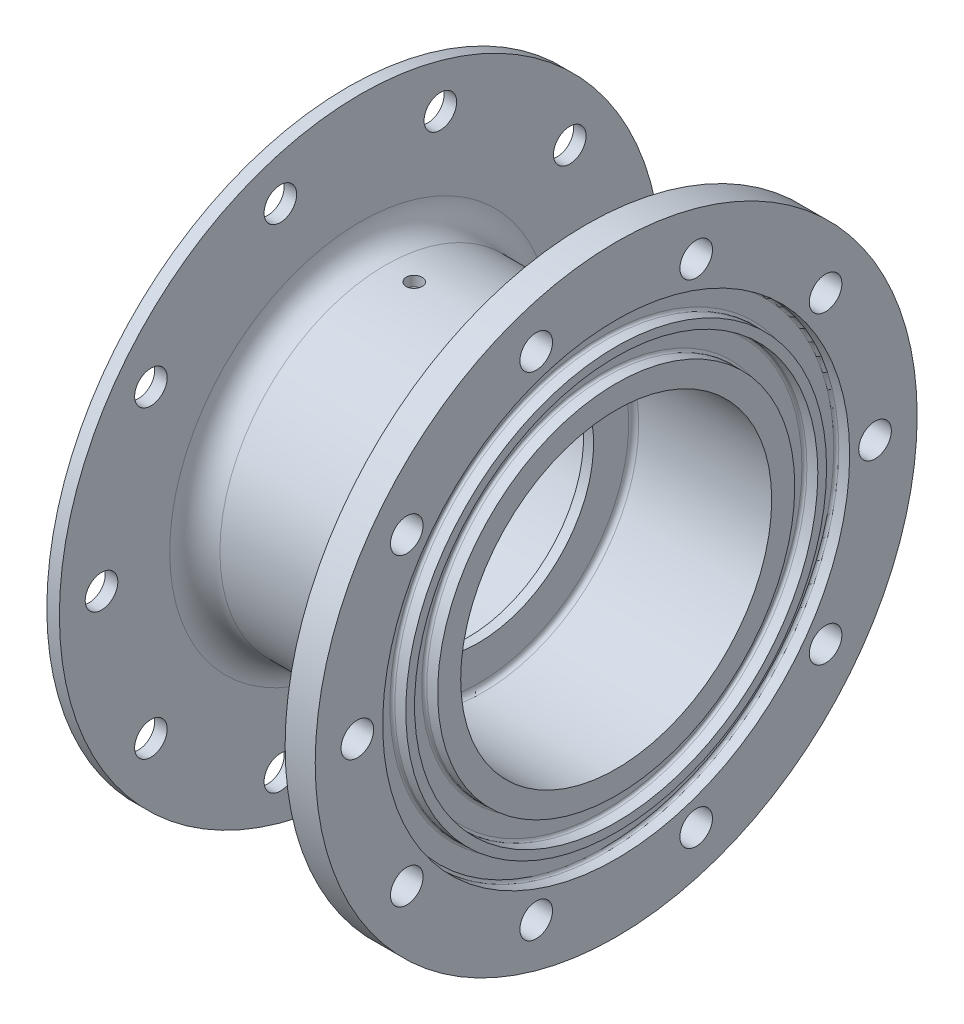
from build123d import *

# Parameters (mm, degrees)
SKETCH3_R                      = 3.25
CUT_EXTRUDE3_DEPTH             = 101.310767119
CIRPATTERN1_COUNT              = 10
F_3_2_3_2_DIAMETER_HOLE1_D     = 3.2
F_3_2_3_2_DIAMETER_HOLE1_DEPTH = 5
F_3_2_3_2_DIAMETER_HOLE1_TIP   = 0.96137699


with BuildPart() as part:
    # Sketch1 → Revolve9 (revolve)
    with BuildSketch(Plane.XY):
        with BuildLine():
            Line((-1, -23), (-1, -30))
            ThreePointArc((-1, -30), (-1.292893219, -30.707106781), (-2, -31))
            Line((-2, -31), (-25, -31))
            Line((-25, -31), (-25, -60))
            Line((-25, -60), (-22.5, -60))
            Line((-22.5, -60), (-22.5, -38))
            ThreePointArc((-22.5, -38), (-21.035533906, -34.464466094), (-17.5, -33))
            Line((-17.5, -33), (17.5, -33))
            ThreePointArc((17.5, -33), (21.035533906, -34.464466094), (22.5, -38))
            Line((22.5, -38), (22.5, -60))
            Line((22.5, -60), (25, -60))
            Line((25, -60), (28.5, -60))
            Line((28.5, -60), (28.5, -31))
            Line((28.5, -31), (25, -31))
            Line((25, -31), (2, -31))
            ThreePointArc((2, -31), (1.292893219, -30.707106781), (1, -30))
            Line((1, -30), (1, -23))
            Line((1, -23), (-1, -23))
        make_face()
    revolve(axis=Axis((-117.507853403, 0, 0), (1, 0, 0)))

    # Sketch3 → Cut-Extrude3 (cut, through all)
    with BuildSketch(Plane.ZY.offset(25)):
        with Locations((-15.94527691, -49.074516241)):
            Circle(SKETCH3_R)
    cut_extrude3 = extrude(amount=-CUT_EXTRUDE3_DEPTH, mode=Mode.SUBTRACT)

    # CirPattern1: Cut-Extrude3 ×10 about axis
    cirpattern1_axis = Axis((0, 0, 0), (-1, 0, 0))
    for i in range(1, CIRPATTERN1_COUNT):
        add(cut_extrude3.rotate(cirpattern1_axis, i * 360 / CIRPATTERN1_COUNT), mode=Mode.SUBTRACT)

    # Ø3.2 (3.2) Diameter Hole1
    with Locations(Plane(origin=(-11.75, 33, 0), x_dir=(0, 0, 1), z_dir=(0, 1, 0))):
        with Locations((0, 0)):
            Hole(F_3_2_3_2_DIAMETER_HOLE1_D / 2, depth=F_3_2_3_2_DIAMETER_HOLE1_DEPTH)
            with Locations((0, 0, -(F_3_2_3_2_DIAMETER_HOLE1_DEPTH + F_3_2_3_2_DIAMETER_HOLE1_TIP / 2))):  # 118° drill point
                Cone(0, F_3_2_3_2_DIAMETER_HOLE1_D / 2, F_3_2_3_2_DIAMETER_HOLE1_TIP, mode=Mode.SUBTRACT)

    # Sketch8 → Cut-Revolve1 (revolve, cut)
    with BuildSketch(Plane.XY):
        with BuildLine():
            Line((28.5, 40.195), (26.33, 40.195))
            ThreePointArc((26.33, 40.195), (25.976446609, 40.048553391), (25.83, 39.695))
            Line((25.83, 39.695), (25.83, 36.095))
            ThreePointArc((25.83, 36.095), (25.976446609, 35.741446609), (26.33, 35.595))
            Line((26.33, 35.595), (28.5, 35.595))
            Line((28.5, 35.595), (28.5, 40.195))
        make_face()
        with BuildLine():
            Line((28.5, 41.945), (26.33, 41.945))
            ThreePointArc((26.33, 41.945), (25.976446609, 42.091446609), (25.83, 42.445))
            Line((25.83, 42.445), (25.83, 46.045))
            ThreePointArc((25.83, 46.045), (25.976446609, 46.398553391), (26.33, 46.545))
            Line((26.33, 46.545), (28.5, 46.545))
            Line((28.5, 46.545), (28.5, 41.945))
        make_face()
    revolve(axis=Axis((28.5, 0, 0), (-1, 0, 0)), mode=Mode.SUBTRACT)


solid = part.part
